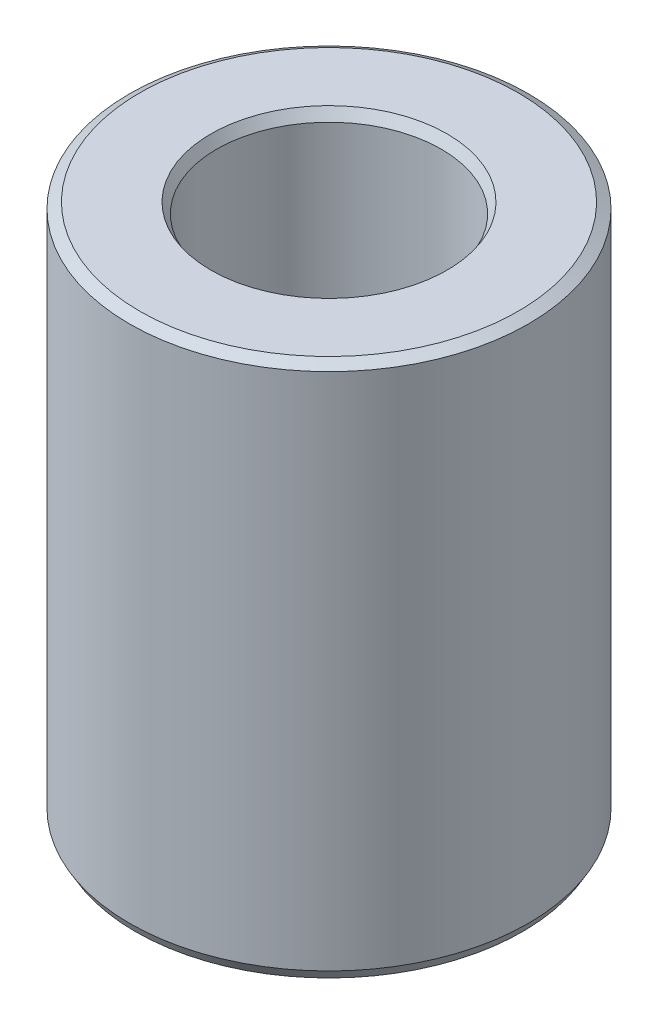
from build123d import *
from OCP.BRepFilletAPI import BRepFilletAPI_MakeChamfer

# Parameters (mm, degrees)
SKETCH1_R           = 55
BOSS_EXTRUDE1_DEPTH = 147.592695688
SKETCH2_R           = 30.945202136
CUT_EXTRUDE1_DEPTH  = 167.834060733
CHAMFER1_SIZE       = 1.627179565
CHAMFER1_SIZE2      = 2.81835768


with BuildPart() as part:
    # Sketch1 → Boss-Extrude1 (new body)
    with BuildSketch(Plane(origin=(0, 0, 0), x_dir=(1, 0, 0), z_dir=(0, 1, 0))):
        Circle(SKETCH1_R)
    extrude(amount=BOSS_EXTRUDE1_DEPTH)

    # Sketch2 → Cut-Extrude1 (cut, through all)
    with BuildSketch(Plane(origin=(0, 0, 0), x_dir=(1, 0, 0), z_dir=(0, 1, 0))):
        Circle(SKETCH2_R)
    extrude(amount=CUT_EXTRUDE1_DEPTH, mode=Mode.SUBTRACT)

    # Chamfer1: one chamfer whose edges measure the first distance from different faces: ONE call of the kernel's chamfer builder (chamfer() names one face for all edges)
    chamfer1_edges_1 = [part.edges().sort_by_distance(p)[0] for p in [
        (-30.945202136, 147.592695688, 0),
    ]]
    chamfer1_side_1 = [part.faces().sort_by_distance(p)[0] for p in [
        (-53.444365081, 147.592695688, 0),
    ]]
    chamfer1_edges_2 = [part.edges().sort_by_distance(p)[0] for p in [
        (-30.945202136, 0, 0),
    ]]
    chamfer1_side_2 = [part.faces().sort_by_distance(p)[0] for p in [
        (-30.945202136, 73.796347844, 0),
    ]]
    chamfer1_edges_3 = [part.edges().sort_by_distance(p)[0] for p in [
        (-55, 0, 0),
    ]]
    chamfer1_side_3 = [part.faces().sort_by_distance(p)[0] for p in [
        (-53.444365081, 0, 0),
    ]]
    chamfer1_edges_4 = [part.edges().sort_by_distance(p)[0] for p in [
        (-55, 147.592695688, 0),
    ]]
    chamfer1_side_4 = [part.faces().sort_by_distance(p)[0] for p in [
        (-55, 73.796347844, 0),
    ]]
    chamfer1 = BRepFilletAPI_MakeChamfer(part.part.solid().wrapped)
    for e in chamfer1_edges_1:
        chamfer1.Add(CHAMFER1_SIZE, CHAMFER1_SIZE2, e.wrapped, chamfer1_side_1[0].wrapped)  # the first distance lies on this face
    for e in chamfer1_edges_2:
        chamfer1.Add(CHAMFER1_SIZE, CHAMFER1_SIZE2, e.wrapped, chamfer1_side_2[0].wrapped)  # the first distance lies on this face
    for e in chamfer1_edges_3:
        chamfer1.Add(CHAMFER1_SIZE, CHAMFER1_SIZE2, e.wrapped, chamfer1_side_3[0].wrapped)  # the first distance lies on this face
    for e in chamfer1_edges_4:
        chamfer1.Add(CHAMFER1_SIZE, CHAMFER1_SIZE2, e.wrapped, chamfer1_side_4[0].wrapped)  # the first distance lies on this face
    add(Compound.cast(chamfer1.Shape()), mode=Mode.REPLACE)


solid = part.part
